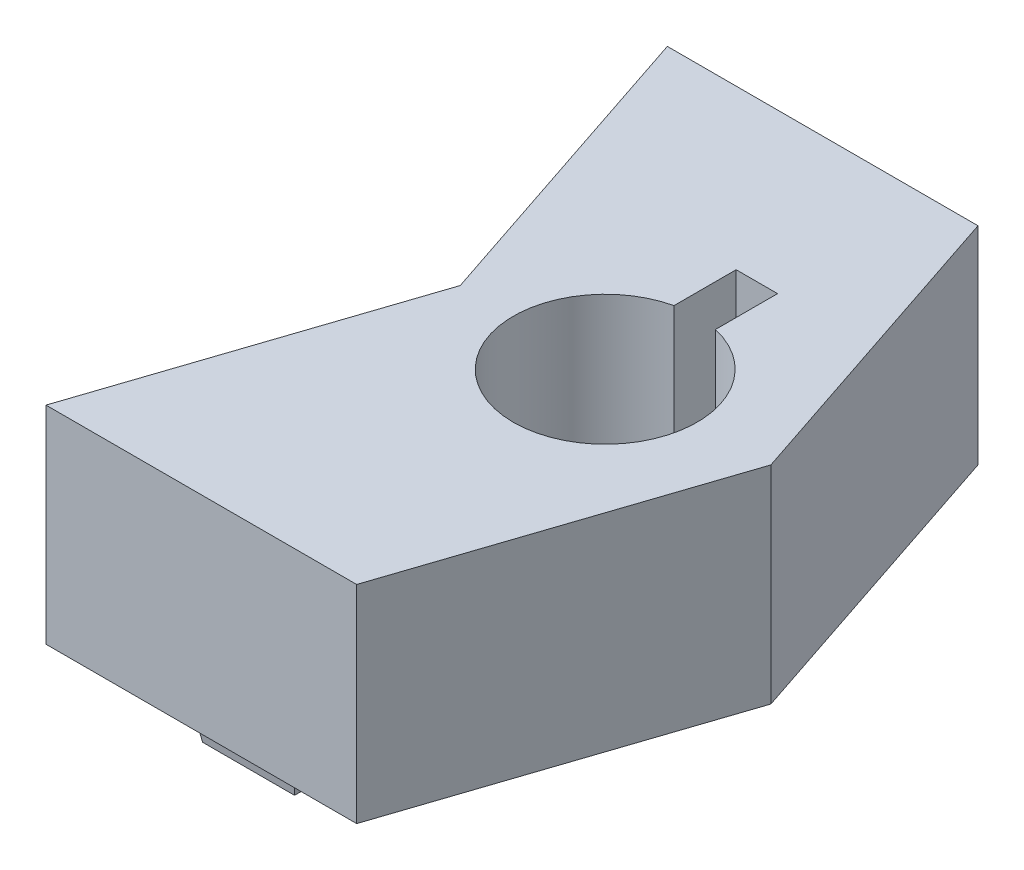
from build123d import *

# Parameters (mm, degrees)
BOSS_EXTRUDE1_DEPTH       = 12.7
SKETCH2_R                 = 5.635000033
HAPTIC_MOTOR_CUTOUT_DEPTH = 9.557999934
SKETCH3_W                 = 2.54
SKETCH3_H                 = 3.81
HAPTIC_WIRE_CUTOUT_DEPTH  = 48.519048812
SKETCH4_W                 = 6.35
SKETCH4_H                 = 2.54
PINS_DEPTH                = 2.032
PINS_TAPER                = 10


with BuildPart() as part:
    # Sketch1 → Boss-Extrude1 (new body)
    with BuildSketch(Plane(origin=(0, 0, 0), x_dir=(1, 0, 0), z_dir=(0, 1, 0))):
        Polygon((0, 0), (19.05, 0), (25.4, 19.05), (19.05, 38.1), (0, 38.1), (6.35, 19.05), align=None)
    extrude(amount=BOSS_EXTRUDE1_DEPTH)

    # Sketch2 → Haptic Motor Cutout (cut)
    with BuildSketch(Plane.XZ.offset(-12.7)):
        with Locations((15.24, -19.05)):
            Circle(SKETCH2_R)
    extrude(amount=HAPTIC_MOTOR_CUTOUT_DEPTH, mode=Mode.SUBTRACT)

    # Sketch3 → Haptic Wire Cutout (cut, through all)
    with BuildSketch(Plane.XZ):
        with Locations((15.24, -26.445020526)):
            Rectangle(SKETCH3_W, SKETCH3_H)
    extrude(amount=-HAPTIC_WIRE_CUTOUT_DEPTH, mode=Mode.SUBTRACT)

    # Sketch4 → Pins (add)
    with BuildSketch(Plane.XZ):
        with Locations((10.795, -35.56)):
            Rectangle(SKETCH4_W, SKETCH4_H)
    pins = extrude(amount=PINS_DEPTH, taper=PINS_TAPER)

    # Mirror1: Pins across plane
    add(pins.mirror(Plane(origin=(0, 0, -19.05), x_dir=(1, 0, 0), z_dir=(0, 0, -1))))


solid = part.part
